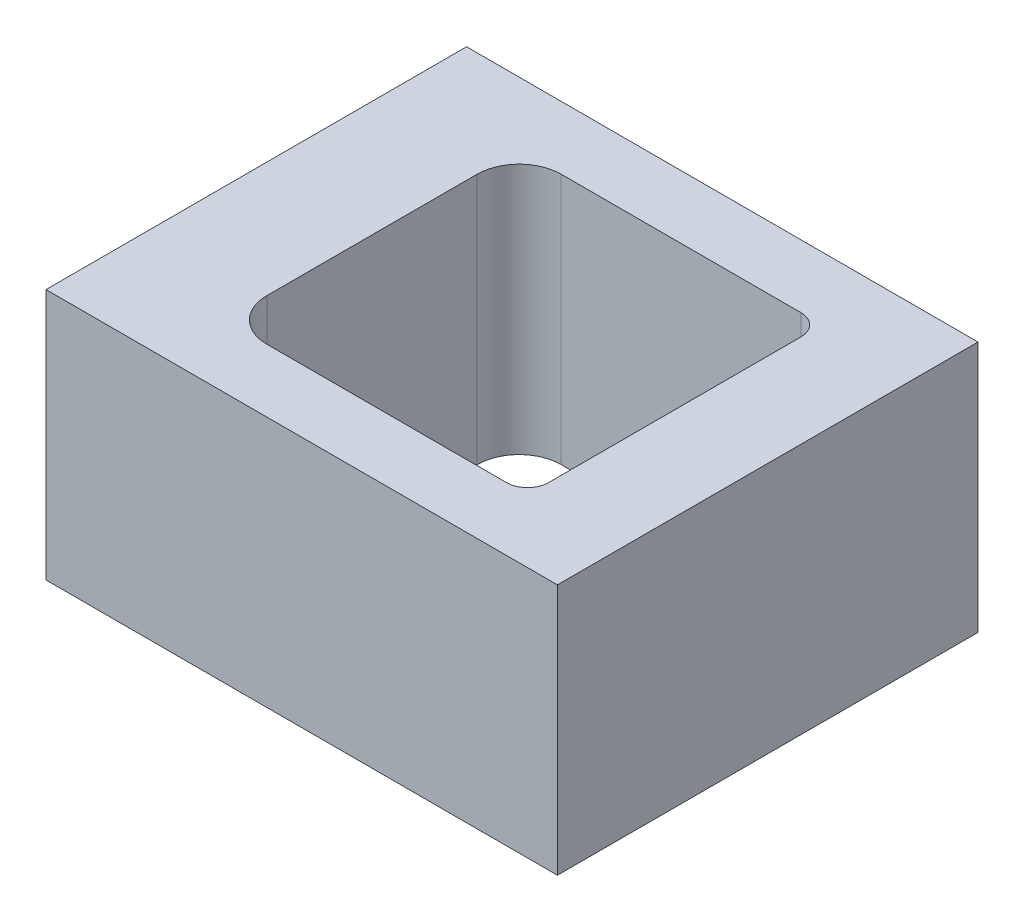
from build123d import *

# Parameters (mm, degrees)
SKETCH1_W           = 154.432
SKETCH1_H           = 127
BOSS_EXTRUDE1_DEPTH = 75.946


with BuildPart() as part:
    # Sketch1 → Boss-Extrude1 (new body)
    with BuildSketch(Plane(origin=(0, 0, 0), x_dir=(1, 0, 0), z_dir=(0, 1, 0))):
        Rectangle(SKETCH1_W, SKETCH1_H)
        with BuildLine():
            Line((-42.291, 31.75), (-42.291, -31.75))
            ThreePointArc((-42.291, -31.75), (-38.571256121, -40.730256121), (-29.591, -44.45))
            Line((-29.591, -44.45), (42.799, -44.45))
            ThreePointArc((42.799, -44.45), (47.289128061, -42.590128061), (49.149, -38.1))
            Line((49.149, -38.1), (49.149, 38.1))
            ThreePointArc((49.149, 38.1), (47.289128061, 42.590128061), (42.799, 44.45))
            Line((42.799, 44.45), (-29.591, 44.45))
            ThreePointArc((-29.591, 44.45), (-38.571256121, 40.730256121), (-42.291, 31.75))
        make_face(mode=Mode.SUBTRACT)
    extrude(amount=BOSS_EXTRUDE1_DEPTH)


solid = part.part
